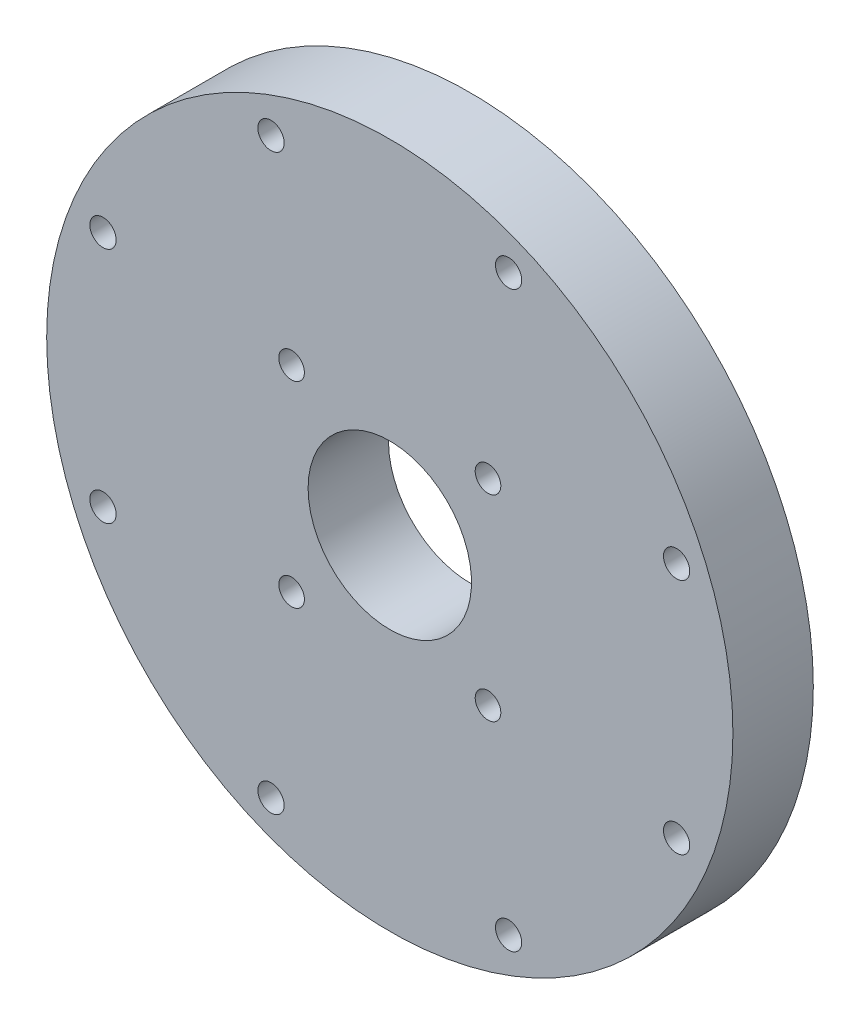
from build123d import *

# Parameters (mm, degrees)
CUT_EXTRUDE2_START                              = 9.275318
CUT_EXTRUDE2_OUTLINE_R                          = 47.625
CUT_EXTRUDE2_DEPTH                              = 8.504682
CBORE_FOR_10_SOCKET_HEAD_CAP_SCREW1_D           = 4.9784
CBORE_FOR_10_SOCKET_HEAD_CAP_SCREW1_CBORE_D     = 9.525
CBORE_FOR_10_SOCKET_HEAD_CAP_SCREW1_CBORE_DEPTH = 4.826
F_10_CLEARANCE_HOLE1_D                          = 5.1054
CIRPATTERN1_COUNT                               = 8
CLEARANCING_START                               = -8.504682
SKETCH25_R                                      = 66.675
CLEARANCING_DEPTH                               = 8.504682


# Read off the part's stored shape, not the designer's step: Cut-Extrude2
with BuildPart() as part:
    # Sketch24 → Revolve1 (revolve)
    with BuildSketch(Plane(origin=(0, 0, 0), x_dir=(1, 0, 0), z_dir=(0, 1, 0))):
        Polygon((-15.875, -33.405318), (-15.875, -17.78), (-34.29, -17.78), (-34.29, -9.275318), (-47.625, -9.275318), (-47.625, -17.78), (-46.0248, -17.78), (-46.0248, -20.9169), (-50.8, -20.9169), (-50.8, -17.78), (-66.675, -17.78), (-66.675, -33.405318), align=None)
    revolve(axis=Axis((0, 0, 0), (0, 0, 1)))

    # Cut-Extrude2 outline → Cut-Extrude2 (cut)
    with BuildSketch(Plane.XY.offset(CUT_EXTRUDE2_START)):
        Circle(CUT_EXTRUDE2_OUTLINE_R)
        with BuildLine():
            add(Edge.make_bspline(
                [(34.641574854, 11.209813305), (34.492866613, 11.743162162), (34.153943811, 12.859819093), (33.555538624, 14.537761538), (32.849887572, 16.240636382), (32.057893687, 17.909346365), (31.181197352, 19.53951152), (30.221662701, 21.126830276), (29.181373626, 22.667090912), (28.062629225, 24.156182809), (26.867938753, 25.590107465), (25.60001603, 26.964989265), (24.261773335, 28.277085961), (22.856314773, 29.522798851), (21.386929147, 30.698682629), (19.85708232, 31.801454876), (18.270409111, 32.828005175), (16.630704717, 33.775403815), (14.941915703, 34.640910073), (13.208130556, 35.421980041), (11.43356985, 36.116273987), (9.622576022, 36.721663214), (7.779602801, 37.236236415), (5.909204301, 37.658305492), (4.016023818, 37.986410831), (2.104782347, 38.219326014), (0.180266852, 38.356061949), (-1.75268168, 38.395870413), (-3.689180377, 38.338246992), (-5.624316777, 38.182933409), (-7.553161251, 37.929919231), (-9.470779522, 37.579442948), (-11.37224525, 37.131992419), (-13.252652651, 36.588304682), (-15.107129112, 35.949365124), (-16.930847778, 35.216406011), (-18.719040078, 34.390904381), (-20.467008144, 33.474579298), (-22.170137115, 32.469388481), (-23.823907266, 31.377524301), (-25.42390596, 30.201409162), (-26.965839357, 28.943690275), (-28.445543888, 27.607233836), (-29.858997424, 26.195118613), (-31.202330147, 24.710628968), (-32.471835063, 23.157247319), (-33.663978152, 21.538646066), (-34.775408104, 19.858679), (-35.802965645, 18.121372202), (-36.743692396, 16.330914471), (-37.594839261, 14.491647299), (-38.353874308, 12.608054401), (-39.018490139, 10.68475085), (-39.586610697, 8.726471825), (-40.056397525, 6.738061006), (-40.426255434, 4.724458642), (-40.694837576, 2.690689328), (-40.861049894, 0.641849508), (-40.924054953, -1.416905249), (-40.883275123, -3.480373184), (-40.738395114, -5.543319447), (-40.489363842, -7.600489337), (-40.13639564, -9.646621653), (-39.679970776, -11.676462103), (-39.120835312, -13.684776759), (-38.460000265, -15.666365517), (-37.698740094, -17.61607551), (-36.838590511, -19.528814477), (-35.881345602, -21.399564006), (-34.829054288, -23.223392663), (-33.684016107, -24.995468936), (-32.44877635, -26.711073982), (-31.126120537, -28.365614138), (-29.719068263, -29.954633155), (-28.230866416, -31.473824138), (-26.664981791, -32.919041144), (-25.025093105, -34.286310417), (-23.315082441, -35.571841228), (-21.53902614, -36.772036288), (-19.701185153, -37.883501708), (-17.805994889, -38.903056478), (-15.85805457, -39.827741435), (-13.862116128, -40.654827709), (-11.823072667, -41.381824596), (-9.745946518, -42.006486871), (-7.635876912, -42.526821485), (-5.498107312, -42.941093656), (-3.337972426, -43.247832311), (-1.160884928, -43.445834888), (1.027678058, -43.534171454), (3.222188708, -43.512188152), (5.417082419, -43.379509955), (7.606771886, -43.136042707), (9.785661288, -42.781974466), (11.948160555, -42.317776118), (14.08869967, -41.74420128), (16.201742982, -41.062285471), (18.281803484, -40.273344558), (20.323457017, -39.378972487), (22.321356376, -38.381038284), (24.27024527, -37.281682345), (26.164972102, -36.083312015), (28.000503535, -34.788596469), (29.77193781, -33.400460899), (31.474517775, -31.92208003), (33.103643596, -30.356870964), (34.654885111, -28.708485383), (36.123993806, -26.980801118), (37.506914359, -25.17791311), (38.799795742, -23.304123775), (39.999001844, -21.363932809), (41.101121576, -19.362026441), (42.102978449, -17.303266175), (43.001639577, -15.192677038), (43.794424103, -13.035435358), (44.478911001, -10.836856121), (45.052946246, -8.602379918), (45.514649334, -6.337559517), (45.847889349, -4.143701635), (46.017592475, -2.510533136), (46.090246085, -1.546597167), (46.115686798, -1.160407225), (46.132959236, -0.870548295), (46.148375241, -0.580516781), (46.162099639, -0.290330355), (46.169705769, -0.096784384), (46.173509282, 0)],
                knots=[0.044023807, 0.044023807, 0.044023807, 0.044023807, 0.050477114, 0.057621232, 0.06478017, 0.071953969, 0.079142669, 0.086346306, 0.093564916, 0.100798534, 0.108047194, 0.115310927, 0.122589766, 0.12988374, 0.13719288, 0.144517215, 0.151856774, 0.159211583, 0.16658167, 0.173967063, 0.181367786, 0.188783866, 0.196215328, 0.203662198, 0.211124498, 0.218602253, 0.226095488, 0.233604225, 0.241128486, 0.248668296, 0.256223676, 0.263794648, 0.271381234, 0.278983456, 0.286601335, 0.294234891, 0.301884146, 0.309549121, 0.317229835, 0.324926308, 0.332638561, 0.340366614, 0.348110485, 0.355870195, 0.363645762, 0.371437205, 0.379244543, 0.387067795, 0.39490698, 0.402762115, 0.410633219, 0.41852031, 0.426423405, 0.434342523, 0.442277682, 0.450228898, 0.458196189, 0.466179572, 0.474179065, 0.482194684, 0.490226447, 0.498274369, 0.506338468, 0.514418761, 0.522515263, 0.530627991, 0.538756962, 0.546902191, 0.555063694, 0.563241488, 0.571435588, 0.57964601, 0.58787277, 0.596115883, 0.604375364, 0.61265123, 0.620943495, 0.629252175, 0.637577285, 0.64591884, 0.654276855, 0.662651345, 0.671042324, 0.679449808, 0.687873812, 0.696314349, 0.704771435, 0.713245083, 0.721735309, 0.730242127, 0.738765551, 0.747305595, 0.755862273, 0.7644356, 0.77302559, 0.781632256, 0.790255613, 0.798895674, 0.807552454, 0.816225965, 0.824916222, 0.833623239, 0.842347028, 0.851087604, 0.859844979, 0.868619169, 0.877410184, 0.88621804, 0.895042749, 0.903884325, 0.912742781, 0.921618129, 0.930510383, 0.939419557, 0.948345662, 0.957288712, 0.96624872, 0.975225699, 0.984219661, 0.99210332, 0.994358185, 0.995486016, 0.996614114, 0.997742477, 0.998871105, 1, 1, 1, 1], degree=3))
            ThreePointArc((34.641574854, 11.209813305), (36.735471945, 8.002059693), (40.293337039, 6.582311745))
            ThreePointArc((40.293337039, 6.582311745), (44.564000123, 4.479799319), (46.173509282, 0))
        make_face(mode=Mode.SUBTRACT)
    extrude(amount=CUT_EXTRUDE2_DEPTH, mode=Mode.SUBTRACT)

    # CBORE for #10 Socket Head Cap Screw1 (through all)
    with Locations(Plane(origin=(19.083044257, -19.083044257, 17.78), x_dir=(-1, 0, 0), z_dir=(0, 0, -1))):
        with Locations((0, 0), (0, 38.166088514), (38.166088514, 38.166088514), (38.166088514, 0)):
            CounterBoreHole(CBORE_FOR_10_SOCKET_HEAD_CAP_SCREW1_D / 2, CBORE_FOR_10_SOCKET_HEAD_CAP_SCREW1_CBORE_D / 2, CBORE_FOR_10_SOCKET_HEAD_CAP_SCREW1_CBORE_DEPTH)

    # #10 Clearance Hole1 (through all)
    with Locations(Plane(origin=(55.733032799, -23.085378057, 17.78), x_dir=(-1, 0, 0), z_dir=(0, 0, -1))):
        with Locations((0, 0)):
            f_10_clearance_hole1 = Hole(F_10_CLEARANCE_HOLE1_D / 2)

    # CirPattern1: #10 Clearance Hole1 ×8 about axis
    cirpattern1_axis = Axis((0, 0, 0), (0, 0, 1))
    for i in range(1, CIRPATTERN1_COUNT):
        add(f_10_clearance_hole1.rotate(cirpattern1_axis, i * 360 / CIRPATTERN1_COUNT), mode=Mode.SUBTRACT)

    # Sketch25 → Clearancing (cut)
    with BuildSketch(Plane(origin=(0, 0, 9.275318), x_dir=(-1, 0, 0), z_dir=(0, 0, -1)).offset(CLEARANCING_START)):
        Circle(SKETCH25_R)
        with BuildLine():
            ThreePointArc((-40.256142642, 6.075675212), (-44.185152679, 4.14136378), (-45.665901105, 0.019948406))
            add(Edge.make_bspline(
                [(-45.665901105, 0.019948406), (-45.640843252, -0.617675003), (-45.604829255, -1.253010819), (-45.504351835, -2.517742345), (-45.441052831, -3.147381178), (-45.212432947, -5.028212524), (-45.008450664, -6.271332714), (-44.242989524, -9.968640212), (-43.52913227, -12.391011617), (-42.138045746, -15.957691436), (-41.626364682, -17.120474764), (-40.512680652, -19.388257745), (-39.910207789, -20.494442857), (-37.96707369, -23.730593733), (-36.49174462, -25.778791172), (-34.411771475, -28.195856513), (-33.985279842, -28.670377793), (-33.116423575, -29.596422364), (-32.673332521, -30.04879752), (-31.318399621, -31.37438599), (-30.380949523, -32.216125582), (-27.46704593, -34.616530673), (-25.389841573, -36.05136872), (-22.062172671, -37.943237182), (-20.930130825, -38.522778109), (-18.633091111, -39.57639236), (-17.46623561, -40.051525518), (-13.91112995, -41.323221397), (-11.468273082, -41.967409438), (-6.43242256, -42.826573909), (-3.914744792, -43.028776038), (-0.138586, -43.003300652), (1.120073594, -42.939681088), (3.007971483, -42.760186242), (3.637255506, -42.686322311), (4.895792474, -42.510042802), (5.526571063, -42.407330429), (8.660443645, -41.824544462), (11.090372365, -41.142352886), (14.623012975, -39.804920602), (15.781736724, -39.306432263), (17.491004632, -38.478051741), (18.055949728, -38.188461399), (19.176029707, -37.581826274), (19.731660414, -37.26438738), (22.456662681, -35.624532778), (24.490489311, -34.13384221), (27.326701243, -31.635387766), (28.236132982, -30.758567046), (29.981154487, -28.914599378), (30.819228008, -27.943481359), (33.171025404, -24.950670888), (34.539973674, -22.835332473), (36.297963516, -19.483904717), (36.83442316, -18.336845345), (37.562280382, -16.569855108), (37.792222154, -15.972450916), (38.221480922, -14.774667607), (38.42145983, -14.172789371), (39.349182921, -11.148685634), (39.862263674, -8.682699789), (40.215714934, -5.541527517), (40.271892159, -4.9103345), (40.354705457, -3.641926337), (40.381354461, -3.003087554), (40.415744918, -1.089891477), (40.378321818, 0.17699807), (40.089998698, 3.952653081), (39.66460968, 6.436627246), (38.66814911, 10.111670481), (38.273517277, 11.333002184), (37.378111134, 13.708459229), (36.876425473, 14.867850039), (35.212263321, 18.262501529), (33.892198877, 20.41503772), (31.966087362, 22.960807794), (31.568415192, 23.460588842), (30.753517199, 24.435348736), (30.335543042, 24.911319081), (29.050471233, 26.305463264), (27.254106693, 28.07441755), (25.292803648, 29.664573356), (23.7585556, 30.788602731), (23.23657543, 31.151827317), (22.171009443, 31.854855296), (21.628884127, 32.193593191), (18.893658644, 33.810617118), (16.607565234, 34.874431278), (13.033225917, 36.129365373), (11.817410682, 36.490482396), (9.955700277, 36.942999941), (9.331375211, 37.078252299), (8.083229873, 37.316282707), (7.458193096, 37.419364645), (4.328251999, 37.856154552), (1.809219852, 37.956379859), (-1.992431203, 37.724910244), (-3.268993537, 37.582194436), (-5.774771117, 37.172490518), (-8.244673009, 36.63892044), (-10.644023937, 35.861762645), (-12.416713296, 35.186281009), (-13.003131207, 34.945657629), (-14.166839857, 34.432897949), (-14.74571793, 34.15994609), (-17.595998473, 32.724883965), (-19.722308373, 31.363177043), (-22.686779283, 29.00829021), (-23.637145616, 28.170868672), (-25.003992637, 26.833248229), (-25.450247046, 26.373128306), (-26.31251867, 25.436365373), (-26.729880148, 24.958475365), (-28.748893153, 22.522226272), (-30.149346389, 20.424978266), (-31.921880839, 17.052584644), (-32.458700819, 15.886348957), (-33.400814883, 13.514922144), (-33.808577866, 12.305934879), (-34.152239482, 11.073376896)],
                knots=[0, 0, 0, 0, 0.0078125, 0.0078125, 0.015625, 0.015625, 0.03125, 0.03125, 0.0625, 0.0625, 0.078125, 0.078125, 0.09375, 0.09375, 0.125, 0.125, 0.1328125, 0.1328125, 0.140625, 0.140625, 0.15625, 0.15625, 0.1875, 0.1875, 0.203125, 0.203125, 0.21875, 0.21875, 0.25, 0.25, 0.28125, 0.28125, 0.296875, 0.296875, 0.3046875, 0.3046875, 0.3125, 0.3125, 0.34375, 0.34375, 0.359375, 0.359375, 0.3671875, 0.3671875, 0.375, 0.375, 0.40625, 0.40625, 0.421875, 0.421875, 0.4375, 0.4375, 0.46875, 0.46875, 0.484375, 0.484375, 0.4921875, 0.4921875, 0.5, 0.5, 0.53125, 0.53125, 0.5390625, 0.5390625, 0.546875, 0.546875, 0.5625, 0.5625, 0.59375, 0.59375, 0.609375, 0.609375, 0.625, 0.625, 0.65625, 0.65625, 0.6640625, 0.6640625, 0.671875, 0.671875, 0.6875, 0.703125, 0.703125, 0.7109375, 0.7109375, 0.71875, 0.71875, 0.75, 0.75, 0.765625, 0.765625, 0.7734375, 0.7734375, 0.78125, 0.78125, 0.8125, 0.8125, 0.828125, 0.828125, 0.84375, 0.859375, 0.859375, 0.8671875, 0.8671875, 0.875, 0.875, 0.90625, 0.90625, 0.921875, 0.921875, 0.9296875, 0.9296875, 0.9375, 0.9375, 0.96875, 0.96875, 0.984375, 0.984375, 1, 1, 1, 1], degree=3))
            ThreePointArc((-34.152239482, 11.073376896), (-36.41364834, 7.609002996), (-40.256142642, 6.075675212))
        make_face(mode=Mode.SUBTRACT)
    extrude(amount=CLEARANCING_DEPTH, mode=Mode.SUBTRACT)


solid = part.part
